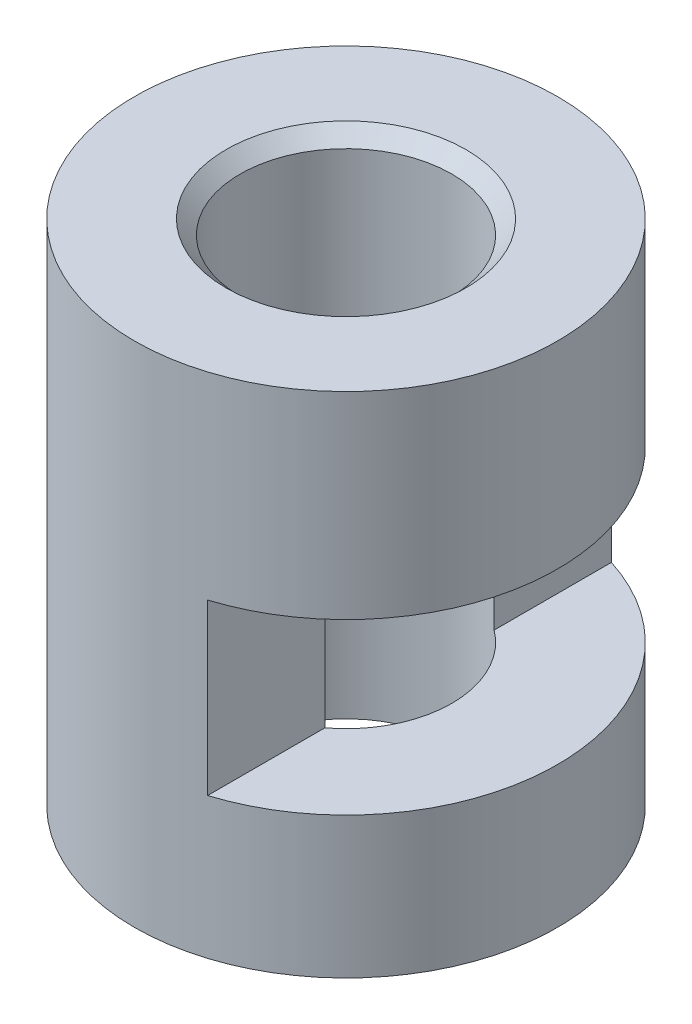
from build123d import *

# Parameters (mm, degrees)
SKETCH1_R               = 3
BOSS_EXTRUDE1_DEPTH     = 7.2
CUT_EXTRUDE1_REACH      = 10.357
SKETCH2_R               = 1.5
CUT_EXTRUDE2_DEPTH      = 9.357032966
CUT_EXTRUDE2_DEPTH_BACK = 9.357032966
SKETCH3_W               = 2.1
SKETCH3_H               = 2.4
CHAMFER1_SIZE           = 0.2


with BuildPart() as part:
    # Sketch1 → Boss-Extrude1 (new body)
    with BuildSketch(Plane(origin=(0, 0, 0), x_dir=(1, 0, 0), z_dir=(0, 1, 0))):
        Circle(SKETCH1_R)
    extrude(amount=BOSS_EXTRUDE1_DEPTH)

    # Sketch2 → Cut-Extrude1 (cut, up to next)
    with BuildSketch(Plane(origin=(0, 7.2, 0), x_dir=(1, 0, 0), z_dir=(0, 1, 0)), mode=Mode.PRIVATE) as cut_extrude1_sk1:
        Circle(SKETCH2_R)
    cut_extrude1_tool1 = extrude(cut_extrude1_sk1.sketch, amount=-CUT_EXTRUDE1_REACH, mode=Mode.PRIVATE) & part.part
    add(cut_extrude1_tool1.solids().sort_by_distance((0, 7.2, 0))[0], mode=Mode.SUBTRACT)

    # Sketch3 → Cut-Extrude2 (cut, two sides: drawn at the far end of the back side and taken through both)
    with BuildSketch(Plane.XY.offset(-CUT_EXTRUDE2_DEPTH_BACK)):
        with Locations((1.95, 3.2)):
            Rectangle(SKETCH3_W, SKETCH3_H)
    extrude(amount=CUT_EXTRUDE2_DEPTH + CUT_EXTRUDE2_DEPTH_BACK, mode=Mode.SUBTRACT)

    # Chamfer1
    chamfer1_edges = [part.edges().sort_by_distance(p)[0] for p in [
        (-1.5, 7.2, 0),
    ]]
    chamfer(chamfer1_edges, length=CHAMFER1_SIZE)


solid = part.part
